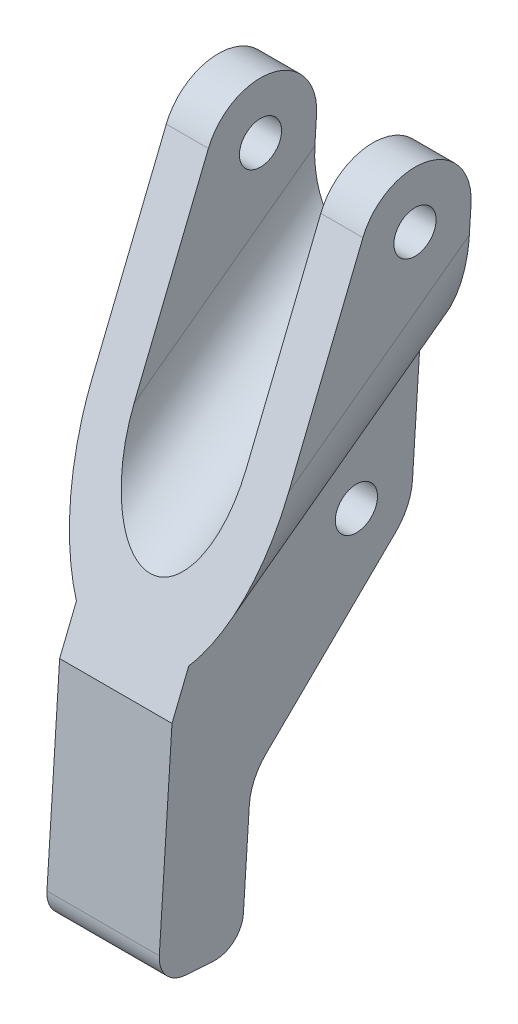
from build123d import *

# Parameters (mm, degrees)
SKETCH_1_R               = 1.5
EXTRUDE_1_DEPTH          = 4
FILLET_1_R               = 2
FILLET_2_R               = 4
SKETCH_2_R               = 1.5
EXTRUDE_2_DEPTH          = 7
CUT_EXTRUDE_1_DEPTH      = 75.524894896
CUT_EXTRUDE_1_DEPTH_BACK = 75.524894896
CUT_EXTRUDE_2_DEPTH      = 2
FILLET_3_R               = 1


with BuildPart() as part:
    # 草图1 → 凸台-拉伸1 (new, symmetric)
    with BuildSketch(Plane(origin=(0, 0, 0), x_dir=(0, 0, -1), z_dir=(1, 0, 0))):
        with BuildLine():
            Line((-59.734284448, 46.23253896), (-60.904491974, 28.270617728))
            ThreePointArc((-60.904491974, 28.270617728), (-61.260668779, 26.862087023), (-62.096445312, 25.67368547))
            Line((-62.096445312, 25.67368547), (-72.42215962, 15.555403796))
            Line((-72.42215962, 15.555403796), (-73.072274912, 5.576558667))
            Line((-73.072274912, 5.576558667), (-79.059581989, 5.966627842))
            Line((-79.059581989, 5.966627842), (-78.025468729, 21.839590984))
            Line((-78.025468729, 21.839590984), (-67.433323191, 47.994063888))
            ThreePointArc((-67.433323191, 47.994063888), (-62.833683596, 50.391827077), (-59.734284448, 46.23253896))
        make_face()
        with Locations((-64.896030026, 28.530663844)):
            Circle(SKETCH_1_R, mode=Mode.SUBTRACT)
        with Locations((-63.7258225, 46.492585076)):
            Circle(SKETCH_1_R, mode=Mode.SUBTRACT)
    extrude(amount=EXTRUDE_1_DEPTH, both=True)

    # 圆角1
    fillet_1_edges = [part.edges().sort_by_distance(p)[0] for p in [
        (0, 5.576558667, 73.072274912),
        (0, 5.966627842, 79.059581989),
    ]]
    fillet(fillet_1_edges, radius=FILLET_1_R)

    # 圆角2
    fillet_2_edges = [part.edges().sort_by_distance(p)[0] for p in [
        (0, 15.555403796, 72.42215962),
    ]]
    fillet(fillet_2_edges, radius=FILLET_2_R)

    # 草图2 → 凸台-拉伸2 (add, symmetric)
    with BuildSketch(Plane(origin=(0, 0, 0), x_dir=(0, 0, -1), z_dir=(1, 0, 0))):
        with BuildLine():
            Line((-60.534478137, 33.950088462), (-59.734284448, 46.23253896))
            ThreePointArc((-59.734284448, 46.23253896), (-62.833683596, 50.391827077), (-67.433323191, 47.994063888))
            Line((-67.433323191, 47.994063888), (-78.025468729, 21.839590984))
            Line((-78.025468729, 21.839590984), (-78.075072521, 21.07820517))
            Line((-78.075072521, 21.07820517), (-60.534478137, 33.950088462))
        make_face()
        with Locations((-63.7258225, 46.492585076)):
            Circle(SKETCH_2_R, mode=Mode.SUBTRACT)
    extrude(amount=EXTRUDE_2_DEPTH, both=True)

    # 草图3 → 切除-拉伸1 (cut, two sides: drawn at the far end of the back side and taken through both)
    with BuildSketch(Plane(origin=(0, 76.493888819, 81.941089709), x_dir=(-1, 0, 0), z_dir=(0, -0.5916260801069638, 0.8062124914296904)).offset(-CUT_EXTRUDE_1_DEPTH_BACK)):
        with BuildLine():
            Line((4, 38.964052974), (4, 30.964052974))
            Line((4, 30.964052974), (-4, 30.964052974))
            Line((-4, 30.964052974), (-4, 38.964052974))
            ThreePointArc((-4, 38.964052974), (0, 42.964052974), (4, 38.964052974))
        make_face()
        with BuildLine():
            Line((7, 38.964052974), (7, 53.964052974))
            Line((7, 53.964052974), (4, 53.964052974))
            Line((4, 53.964052974), (4, 44.70861562))
            ThreePointArc((4, 44.70861562), (6.204836823, 42.204423323), (7, 38.964052974))
        make_face()
        with BuildLine():
            Line((-4, 53.964052974), (-4, 44.70861562))
            ThreePointArc((-4, 44.70861562), (-6.204836823, 42.204423323), (-7, 38.964052974))
            Line((-7, 38.964052974), (-7, 53.964052974))
            Line((-7, 53.964052974), (-4, 53.964052974))
        make_face()
    extrude(amount=CUT_EXTRUDE_1_DEPTH + CUT_EXTRUDE_1_DEPTH_BACK, mode=Mode.SUBTRACT)

    # 草图4 → 切除-拉伸2 (cut, symmetric)
    with BuildSketch(Plane(origin=(0, 0, 0), x_dir=(0, 0, -1), z_dir=(1, 0, 0))):
        with BuildLine():
            Line((-68.896030026, 28.530663844), (-68.896030026, 30.611669816))
            Line((-68.896030026, 30.611669816), (-72.22581768, 28.168158659))
            Line((-72.22581768, 28.168158659), (-75.063263573, 21.161844268))
            Line((-75.063263573, 21.161844268), (-76.06592845, 5.771593254))
            Line((-76.06592845, 5.771593254), (-75.068043938, 5.706581725))
            ThreePointArc((-75.068043938, 5.706581725), (-73.618739254, 6.199188753), (-72.942251853, 7.572327692))
            Line((-72.942251853, 7.572327692), (-72.52160152, 14.029035582))
            ThreePointArc((-72.52160152, 14.029035582), (-72.165424714, 15.437566287), (-71.329648181, 16.62596784))
            Line((-71.329648181, 16.62596784), (-62.096445312, 25.67368547))
            ThreePointArc((-62.096445312, 25.67368547), (-66.445491407, 24.842958673), (-68.896030026, 28.530663844))
        make_face()
    extrude(amount=CUT_EXTRUDE_2_DEPTH, both=True, mode=Mode.SUBTRACT)

    # 圆角3
    fillet_3_edges = [part.edges().sort_by_distance(p)[0] for p in [
        (0, 28.168158659, 72.22581768),
        (0, 30.611669816, 68.896030026),
        (0, 5.771593254, 76.06592845),
        (0, 21.161844268, 75.063263573),
    ]]
    fillet(fillet_3_edges, radius=FILLET_3_R - 0.0001)  # a hair under: the kernel refuses the full size


solid = part.part
